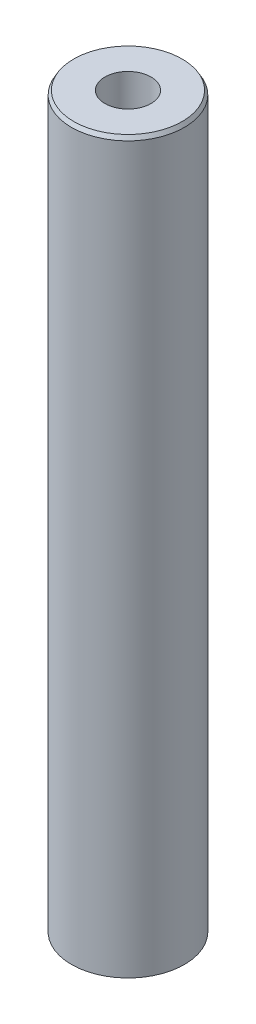
from build123d import *
from OCP.BRepFilletAPI import BRepFilletAPI_MakeChamfer

# Parameters (mm, degrees)
SKETCH1_R           = 10
BOSS_EXTRUDE1_DEPTH = 129.464974264
SKETCH2_R           = 4.082173406
CUT_EXTRUDE1_DEPTH  = 131.235093432
CHAMFER1_SIZE       = 0.697264923
CHAMFER1_SIZE2      = 0.402566091


with BuildPart() as part:
    # Sketch1 → Boss-Extrude1 (new body)
    with BuildSketch(Plane(origin=(0, 0, 0), x_dir=(1, 0, 0), z_dir=(0, 1, 0))):
        Circle(SKETCH1_R)
    extrude(amount=BOSS_EXTRUDE1_DEPTH)

    # Sketch2 → Cut-Extrude1 (cut, through all)
    with BuildSketch(Plane(origin=(0, 0, 0), x_dir=(1, 0, 0), z_dir=(0, 1, 0))):
        Circle(SKETCH2_R)
    extrude(amount=CUT_EXTRUDE1_DEPTH, mode=Mode.SUBTRACT)

    # Chamfer1: one chamfer whose edges measure the first distance from different faces: ONE call of the kernel's chamfer builder (chamfer() names one face for all edges)
    chamfer1_edges_1 = [part.edges().sort_by_distance(p)[0] for p in [
        (-10, 129.464974264, 0),
    ]]
    chamfer1_side_1 = [part.faces().sort_by_distance(p)[0] for p in [
        (-10, 64.732487132, 0),
    ]]
    chamfer1_edges_2 = [part.edges().sort_by_distance(p)[0] for p in [
        (-10, 0, 0),
    ]]
    chamfer1_side_2 = [part.faces().sort_by_distance(p)[0] for p in [
        (-9.717157288, 0, 0),
    ]]
    chamfer1 = BRepFilletAPI_MakeChamfer(part.part.solid().wrapped)
    for e in chamfer1_edges_1:
        chamfer1.Add(CHAMFER1_SIZE, CHAMFER1_SIZE2, e.wrapped, chamfer1_side_1[0].wrapped)  # the first distance lies on this face
    for e in chamfer1_edges_2:
        chamfer1.Add(CHAMFER1_SIZE, CHAMFER1_SIZE2, e.wrapped, chamfer1_side_2[0].wrapped)  # the first distance lies on this face
    add(Compound.cast(chamfer1.Shape()), mode=Mode.REPLACE)


solid = part.part
